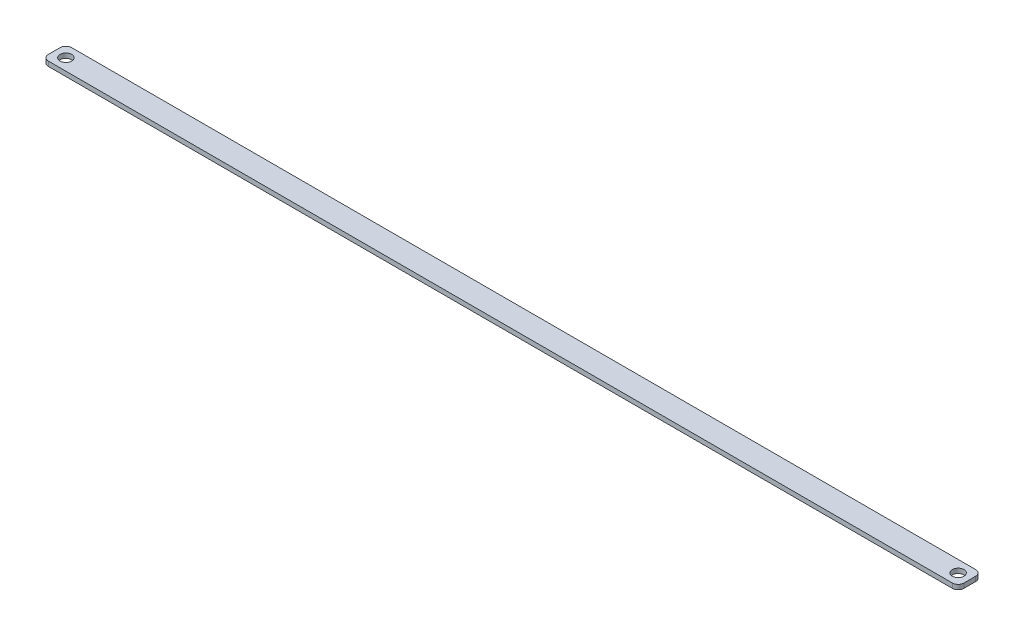
from build123d import *

# Parameters (mm, degrees)
SKETCH1_R           = 2.5
BOSS_EXTRUDE2_DEPTH = 2
FLEX1_OUTLINE_R     = 2.5
FLEX1_DEPTH         = 2


# Read off the part's stored shape, not the designer's step: Flex1
with BuildPart() as part:
    # Sketch1 → Boss-Extrude2 (new body)
    with BuildSketch(Plane(origin=(0, 0, 0), x_dir=(1, 0, 0), z_dir=(0, 1, 0))):
        with BuildLine():
            Line((2.5, 0), (47.5, 0))
            ThreePointArc((47.5, 0), (49.267766953, 0.732233047), (50, 2.5))
            Line((50, 2.5), (50, 7.5))
            ThreePointArc((50, 7.5), (49.267766953, 9.267766953), (47.5, 10))
            Line((47.5, 10), (2.5, 10))
            ThreePointArc((2.5, 10), (0.732233047, 9.267766953), (0, 7.5))
            Line((0, 7.5), (0, 2.5))
            ThreePointArc((0, 2.5), (0.732233047, 0.732233047), (2.5, 0))
        make_face()
        with Locations(Location((5, 5, 0), (0, 0, 270))):
            Circle(SKETCH1_R, mode=Mode.SUBTRACT)
        with Locations(Location((45, 5, 0), (0, 0, 270))):
            Circle(SKETCH1_R, mode=Mode.SUBTRACT)
    extrude(amount=BOSS_EXTRUDE2_DEPTH)

    # Flex1 outline → Flex1 (add)
    # profile 1 of 4: a face of its own
    with BuildSketch(Plane(origin=(0, 0, 0), x_dir=(1, 0, 0), z_dir=(0, 1, 0))):
        with BuildLine():
            Line((2.5, 10), (-164.858311586, 10))
            ThreePointArc((-164.858311586, 10), (-166.626078539, 9.267766953), (-167.358311586, 7.5))
            Line((-167.358311586, 7.5), (-167.358311586, 2.5))
            ThreePointArc((-167.358311586, 2.5), (-166.626078539, 0.732233047), (-164.858311586, 0))
            Line((-164.858311586, 0), (2.5, 0))
            ThreePointArc((2.5, 0), (0.732233047, 0.732233047), (0, 2.5))
            Line((0, 2.5), (0, 7.5))
            ThreePointArc((0, 7.5), (0.732233047, 9.267766953), (2.5, 10))
        make_face()
        with Locations((-162.358311586, 5)):
            Circle(FLEX1_OUTLINE_R, mode=Mode.SUBTRACT)
    # profile 2 of 4: a face of its own
    with BuildSketch(Plane(origin=(0, 0, 0), x_dir=(1, 0, 0), z_dir=(0, 1, 0))):
        with BuildLine():
            Line((223.141688414, 10), (47.5, 10))
            ThreePointArc((47.5, 10), (49.267766953, 9.267766953), (50, 7.5))
            Line((50, 7.5), (50, 2.5))
            ThreePointArc((50, 2.5), (49.267766953, 0.732233047), (47.5, 0))
            Line((47.5, 0), (223.141688414, 0))
            ThreePointArc((223.141688414, 0), (224.909455367, 0.732233047), (225.641688414, 2.5))
            Line((225.641688414, 2.5), (225.641688414, 7.5))
            ThreePointArc((225.641688414, 7.5), (224.909455367, 9.267766953), (223.141688414, 10))
        make_face()
        with Locations((220.641688414, 5)):
            Circle(FLEX1_OUTLINE_R, mode=Mode.SUBTRACT)
    # profile 3 of 4: a face of its own
    with BuildSketch(Plane(origin=(0, 0, 0), x_dir=(1, 0, 0), z_dir=(0, 1, 0))):
        with Locations((5, 5)):
            Circle(FLEX1_OUTLINE_R)
    # profile 4 of 4: a face of its own
    with BuildSketch(Plane(origin=(0, 0, 0), x_dir=(1, 0, 0), z_dir=(0, 1, 0))):
        with Locations((45, 5)):
            Circle(FLEX1_OUTLINE_R)
    extrude(amount=FLEX1_DEPTH)


solid = part.part
